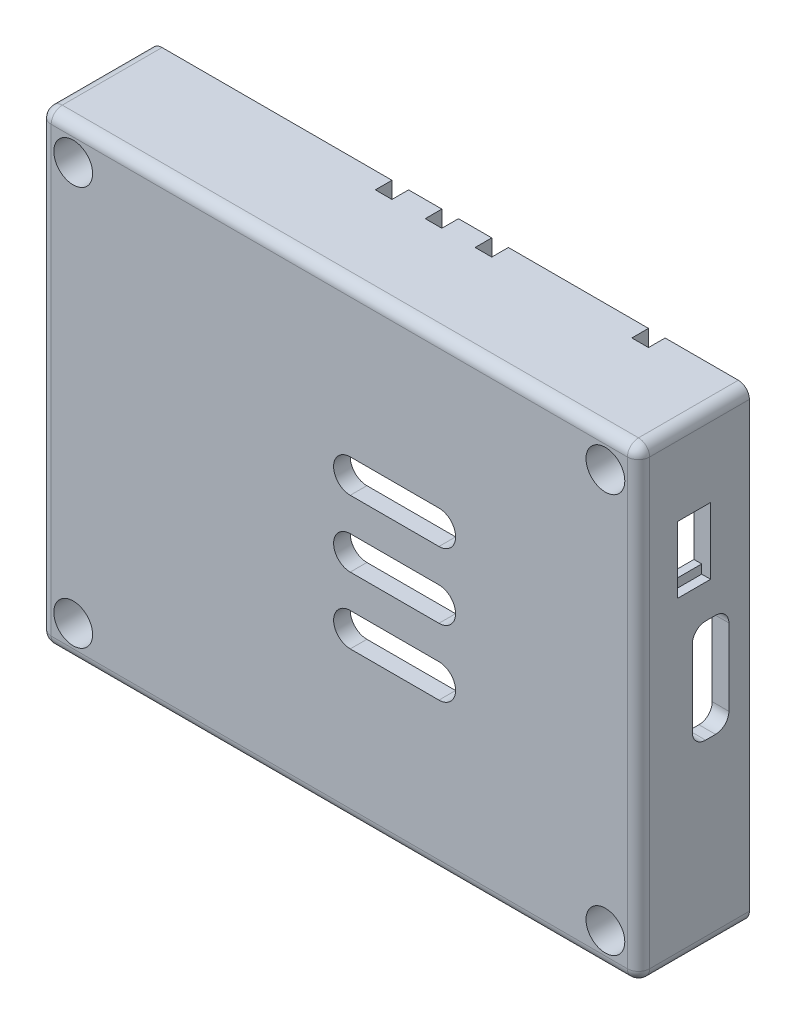
from build123d import *

# Parameters (mm, degrees)
SKETCH_3_W           = 53.974572009
SKETCH_3_H           = 41.974503429
EXTRUDE_1_DEPTH      = 10
CUT_EXTRUDE_1_DEPTH  = 8.5
EXTRUDE_2_DEPTH      = 1
CUT_EXTRUDE_6_DEPTH  = 1
CUT_EXTRUDE_7_DEPTH  = 1.5
SKETCH_8_R           = 2.25
SKETCH_8_R_2         = 0.625
SKETCH_8_W           = 1.487302515
SKETCH_8_H           = 2
SKETCH_8_W_2         = 1.487302514
SKETCH_8_W_3         = 1.487325374
EXTRUDE_3_DEPTH      = 5
SKETCH_9_R           = 0.9
CUT_EXTRUDE_8_DEPTH  = 67.506767514
SKETCH_10_R          = 1.75
CUT_EXTRUDE_9_DEPTH  = 8.8
SKETCH_11_W          = 1.5
SKETCH_11_H          = 1.5
CUT_EXTRUDE_10_DEPTH = 1.5
CUT_EXTRUDE_START    = -1.500038
SKETCH_13_W          = 3.3
SKETCH_13_H          = 9.3
CUT_EXTRUDE_16_DEPTH = 1.500038
FILLET_2_R           = 1.2
SKETCH_14_W          = 1.5
SKETCH_14_H          = 10
CUT_EXTRUDE_17_DEPTH = 1.8
SKETCH_15_W          = 3
SKETCH_15_H          = 6
CUT_EXTRUDE_18_DEPTH = 0.8
SKETCH_16_W          = 3
SKETCH_16_H          = 4.4
CUT_EXTRUDE_19_DEPTH = 0.700027817
CHAMFER_1_SIZE       = 1.6
CHAMFER_1_SIZE_2     = 5
FILLET_4_R           = 1
SKETCH_17_W          = 1.5
SKETCH_17_H          = 2.002821173
SKETCH_17_H_2        = 1.9255419
SKETCH_17_H_3        = 1.925541899
CUT_EXTRUDE_20_DEPTH = 1.5


with BuildPart() as part:
    # 草图3 → 凸台-拉伸1 (new body)
    with BuildSketch(Plane.XY):
        with Locations((-20.223936838, 24.775730738)):
            Rectangle(SKETCH_3_W, SKETCH_3_H)
    extrude(amount=EXTRUDE_1_DEPTH)

    # 草图4 → 切除-拉伸1 (cut)
    with BuildSketch(Plane.XY):
        with BuildLine():
            Line((0.763318687, 42.775657077), (0.763318687, 44.262982452))
            Line((0.763318687, 44.262982452), (-41.211192362, 44.262982452))
            Line((-41.211192362, 44.262982452), (-41.211192362, 42.775679937))
            ThreePointArc((-41.211192362, 42.775679937), (-42.093593258, 40.645375728), (-44.223897468, 39.762974832))
            Line((-44.223897468, 39.762974832), (-45.711222842, 39.762974832))
            Line((-45.711222842, 39.762974832), (-45.711222842, 9.788486643))
            Line((-45.711222842, 9.788486643), (-44.223920328, 9.788486643))
            ThreePointArc((-44.223920328, 9.788486643), (-42.093616118, 8.906085747), (-41.211215222, 6.775781538))
            Line((-41.211215222, 6.775781538), (-41.211215222, 5.288456163))
            Line((-41.211215222, 5.288456163), (0.763295827, 5.288456163))
            Line((0.763295827, 5.288456163), (0.763295827, 6.775758677))
            ThreePointArc((0.763295827, 6.775758677), (1.645696722, 8.906062887), (3.776000932, 9.788463783))
            Line((3.776000932, 9.788463783), (5.263303447, 9.788463783))
            Line((5.263303447, 9.788463783), (5.263326307, 39.762951972))
            Line((5.263326307, 39.762951972), (3.776023792, 39.762951972))
            ThreePointArc((3.776023792, 39.762951972), (1.645719582, 40.645352868), (0.763318687, 42.775657077))
        make_face()
    extrude(amount=CUT_EXTRUDE_1_DEPTH, mode=Mode.SUBTRACT)

    # 草图5 → 凸台-拉伸2 (add)
    with BuildSketch(Plane(origin=(0, 0, 8.5), x_dir=(-1, 0, 0), z_dir=(0, 0, -1))):
        with BuildLine():
            Line((6.736650833, 20.275730737), (6.736650833, 29.275730737))
            ThreePointArc((6.736650833, 29.275730737), (15.236650833, 37.775730737), (23.736650833, 29.275730737))
            Line((23.736650833, 29.275730737), (23.736650833, 20.275730737))
            ThreePointArc((23.736650833, 20.275730737), (15.236650833, 11.775730737), (6.736650833, 20.275730737))
        make_face()
        with BuildLine():
            Line((7.486650833, 20.275730737), (7.486650833, 29.275730737))
            ThreePointArc((7.486650833, 29.275730737), (15.236650833, 37.025730737), (22.986650833, 29.275730737))
            Line((22.986650833, 29.275730737), (22.986650833, 20.275730737))
            ThreePointArc((22.986650833, 20.275730737), (15.236650833, 12.525730737), (7.486650833, 20.275730737))
        make_face(mode=Mode.SUBTRACT)
    extrude(amount=EXTRUDE_2_DEPTH)

    # 草图6 → 切除-拉伸6 (cut)
    with BuildSketch(Plane(origin=(0, 0, 7.5), x_dir=(-1, 0, 0), z_dir=(0, 0, -1))):
        Polygon((6.736650833, 28.775730737), (12.736650833, 28.775730737), (12.736650833, 39.407106511), (17.736650833, 39.407106511), (17.736650833, 28.775730737), (23.736650833, 28.775730737), (23.736650833, 20.775730737), (17.736650833, 20.775730737), (17.736650833, 10.144354964), (12.736650833, 10.144354964), (12.736650833, 20.775730737), (6.736650833, 20.775730737), align=None)
    extrude(amount=-CUT_EXTRUDE_6_DEPTH, mode=Mode.SUBTRACT)

    # 草图7 → 切除-拉伸7 (cut)
    with BuildSketch(Plane(origin=(0, 0, 8.5), x_dir=(-1, 0, 0), z_dir=(0, 0, -1))):
        with BuildLine():
            Line((11.236650833, 26.275730737), (19.236650833, 26.275730737))
            ThreePointArc((19.236650833, 26.275730737), (20.736650833, 24.775730737), (19.236650833, 23.275730737))
            Line((19.236650833, 23.275730737), (11.236650833, 23.275730737))
            ThreePointArc((11.236650833, 23.275730737), (9.736650833, 24.775730737), (11.236650833, 26.275730737))
        make_face()
        with BuildLine():
            Line((11.236650833, 20.275730737), (19.236650833, 20.275730737))
            ThreePointArc((19.236650833, 20.275730737), (20.736650833, 18.775730737), (19.236650833, 17.275730737))
            Line((19.236650833, 17.275730737), (11.236650833, 17.275730737))
            ThreePointArc((11.236650833, 17.275730737), (9.736650833, 18.775730737), (11.236650833, 20.275730737))
        make_face()
        with BuildLine():
            Line((11.236650833, 29.275730737), (19.236650833, 29.275730737))
            ThreePointArc((19.236650833, 29.275730737), (20.736650833, 30.775730737), (19.236650833, 32.275730737))
            Line((19.236650833, 32.275730737), (11.236650833, 32.275730737))
            ThreePointArc((11.236650833, 32.275730737), (9.736650833, 30.775730737), (11.236650833, 29.275730737))
        make_face()
    extrude(amount=-CUT_EXTRUDE_7_DEPTH, mode=Mode.SUBTRACT)


with BuildPart() as extrude_3_tool:
    # 草图8 → 凸台-拉伸3 (new body)
    # profile 1 of 4: a face of its own
    with BuildSketch(Plane(origin=(0, 0, 8.5), x_dir=(-1, 0, 0), z_dir=(0, 0, -1))):
        with Locations(Location((4.023897468, 32.275679937, 0), (0, 0, 180))):
            Circle(SKETCH_8_R)
        with Locations((4.023897468, 32.275679937)):
            Circle(SKETCH_8_R_2, mode=Mode.SUBTRACT)
    # profile 2 of 4: a face of its own
    with BuildSketch(Plane(origin=(0, 0, 8.5), x_dir=(-1, 0, 0), z_dir=(0, 0, -1))):
        with Locations((-4.51965219, 10.788463783)):
            Rectangle(SKETCH_8_W, SKETCH_8_H)
    # profile 3 of 4: a face of its own
    with BuildSketch(Plane(origin=(0, 0, 8.5), x_dir=(-1, 0, 0), z_dir=(0, 0, -1))):
        with Locations((44.967571585, 10.788486643)):
            Rectangle(SKETCH_8_W_2, SKETCH_8_H)
    # profile 4 of 4: a face of its own
    with BuildSketch(Plane(origin=(0, 0, 8.5), x_dir=(-1, 0, 0), z_dir=(0, 0, -1))):
        with Locations((44.967560155, 38.762974832)):
            Rectangle(SKETCH_8_W_3, SKETCH_8_H)
    extrude(amount=EXTRUDE_3_DEPTH)


with BuildPart() as part_1:
    add(part.part)


with BuildPart() as part_2:
    # 凸台-拉伸3: joined with extrude_3_tool
    add(part_1.part.fuse(extrude_3_tool.part, tol=0.00001))

    # 草图9 → 切除-拉伸8 (cut, through all)
    with BuildSketch(Plane.XY.offset(10)):
        with Locations((-44.223897468, 42.775679937)):
            Circle(SKETCH_9_R)
        with Locations(Location((3.776023792, 42.775679937, 0), (0, 0, 180))):
            Circle(SKETCH_9_R)
        with Locations((3.776023792, 6.775781538)):
            Circle(SKETCH_9_R)
        with Locations(Location((-44.223897468, 6.775781538, 0), (0, 0, 180))):
            Circle(SKETCH_9_R)
    extrude(amount=-CUT_EXTRUDE_8_DEPTH, mode=Mode.SUBTRACT)

    # 草图10 → 切除-拉伸9 (cut)
    with BuildSketch(Plane.XY.offset(10)):
        with Locations((-44.223897468, 42.775679937)):
            Circle(SKETCH_10_R)
        with Locations((3.776023792, 42.775657077)):
            Circle(SKETCH_10_R)
        with Locations((3.776000932, 6.775758677)):
            Circle(SKETCH_10_R)
        with Locations((-44.223920328, 6.775781538)):
            Circle(SKETCH_10_R)
    extrude(amount=-CUT_EXTRUDE_9_DEPTH, mode=Mode.SUBTRACT)

    # 草图11 → 切除-拉伸10 (cut)
    with BuildSketch(Plane(origin=(0, 0, 0), x_dir=(-1, 0, 0), z_dir=(0, 0, -1))):
        with Locations((1.586650833, 45.012982452)):
            Rectangle(SKETCH_11_W, SKETCH_11_H)
    extrude(amount=-CUT_EXTRUDE_10_DEPTH, mode=Mode.SUBTRACT)

    # 草图13 → 切除-拉伸16 (cut)
    with BuildSketch(Plane(origin=(6.763349167, 0, 0), x_dir=(0, 0, -1), z_dir=(1, 0, 0)).offset(CUT_EXTRUDE_START)):
        with Locations((-3.5, 24.775730737)):
            Rectangle(SKETCH_13_W, SKETCH_13_H)
    extrude(amount=CUT_EXTRUDE_16_DEPTH, mode=Mode.SUBTRACT)

    # 圆角2
    fillet_2_edges = [part_2.edges().sort_by_distance(p)[0] for p in [
        (6.013330167, 20.125730737, 1.85),
        (6.013333795, 29.425730737, 1.85),
        (6.013333795, 29.425730737, 5.15),
        (6.013330167, 20.125730737, 5.15),
    ]]
    fillet(fillet_2_edges, radius=FILLET_2_R)

    # 草图14 → 切除-拉伸17 (cut)
    with BuildSketch(Plane(origin=(0, 0, 0), x_dir=(-1, 0, 0), z_dir=(0, 0, -1))):
        with Locations((46.461222842, 24.775730737)):
            Rectangle(SKETCH_14_W, SKETCH_14_H)
    extrude(amount=-CUT_EXTRUDE_17_DEPTH, mode=Mode.SUBTRACT)

    # 草图15 → 切除-拉伸18 (cut)
    with BuildSketch(Plane(origin=(6.763349167, 0, 0), x_dir=(0, 0, -1), z_dir=(1, 0, 0))):
        with Locations((-5, 35.462982452)):
            Rectangle(SKETCH_15_W, SKETCH_15_H)
    extrude(amount=-CUT_EXTRUDE_18_DEPTH, mode=Mode.SUBTRACT)

    # 草图16 → 切除-拉伸19 (cut)
    with BuildSketch(Plane(origin=(5.963349167, 0, 0), x_dir=(0, 0, -1), z_dir=(1, 0, 0))):
        with Locations((-5, 35.462982452)):
            Rectangle(SKETCH_16_W, SKETCH_16_H)
    extrude(amount=-CUT_EXTRUDE_19_DEPTH, mode=Mode.SUBTRACT)

    # 倒角1
    # the kernel refuses this chamfer: 5, 1.6 mm, written as the material it adds along each edge
    with BuildSketch(Plane(origin=(-4.023897468, 32.275679937, 8.5), x_dir=(1, 0, 0), z_dir=(0, 1, 0))) as chamfer_1_piece_1_section:
        Polygon((2.25 + CHAMFER_1_SIZE, 0), (2.25, CHAMFER_1_SIZE_2), (2.25, 0), align=None)
    chamfer_1_piece_1 = revolve(axis=Axis((-4.023897468, 32.275679937, 8.5), (0, 0, -1)), mode=Mode.PRIVATE)
    chamfer_1_piece_1 = split(chamfer_1_piece_1, bisect_by=Plane(origin=(-4.023897468, 32.275679937, 3.5), z_dir=(0, 0, 1)), keep=Keep.TOP, mode=Mode.PRIVATE)
    add(chamfer_1_piece_1)

    # 圆角4
    fillet_4_edges = [part_2.edges().sort_by_distance(p)[0] for p in [
        (6.763349167, 24.775730737, 10),
        (-20.223936838, 45.762982452, 10),
        (-47.211222842, 24.775730737, 10),
        (-47.211222842, 45.762982452, 5),
        (6.763349167, 45.762982452, 5),
        (6.763349167, 3.788479023, 5),
        (-47.211222842, 3.788479023, 5),
        (-20.223936838, 3.788479023, 10),
    ]]
    fillet(fillet_4_edges, radius=FILLET_4_R)

    # 草图17 → 切除-拉伸20 (cut)
    with BuildSketch(Plane(origin=(0, 0, 0), x_dir=(-1, 0, 0), z_dir=(0, 0, -1))):
        with Locations((20.223959698, 4.475678125)):
            Rectangle(SKETCH_17_W, SKETCH_17_H)
        Polygon((14.973959667, 5.502842281), (14.973961937, 3.577300382), (16.473961937, 3.57730215), (16.473959667, 5.502844049), align=None)
        with Locations((24.723959698, 4.54007752)):
            Rectangle(SKETCH_17_W, SKETCH_17_H_2)
        Polygon((16.473959667, 44.048617426), (14.973959667, 44.048619194), (14.973961937, 45.974161093), (16.473961937, 45.974159325), align=None)
        with Locations((24.723959698, 45.011383955)):
            Rectangle(SKETCH_17_W, SKETCH_17_H_3)
        with Locations((20.223959698, 45.075783349)):
            Rectangle(SKETCH_17_W, SKETCH_17_H)
    extrude(amount=-CUT_EXTRUDE_20_DEPTH, mode=Mode.SUBTRACT)


solid = part_2.part
